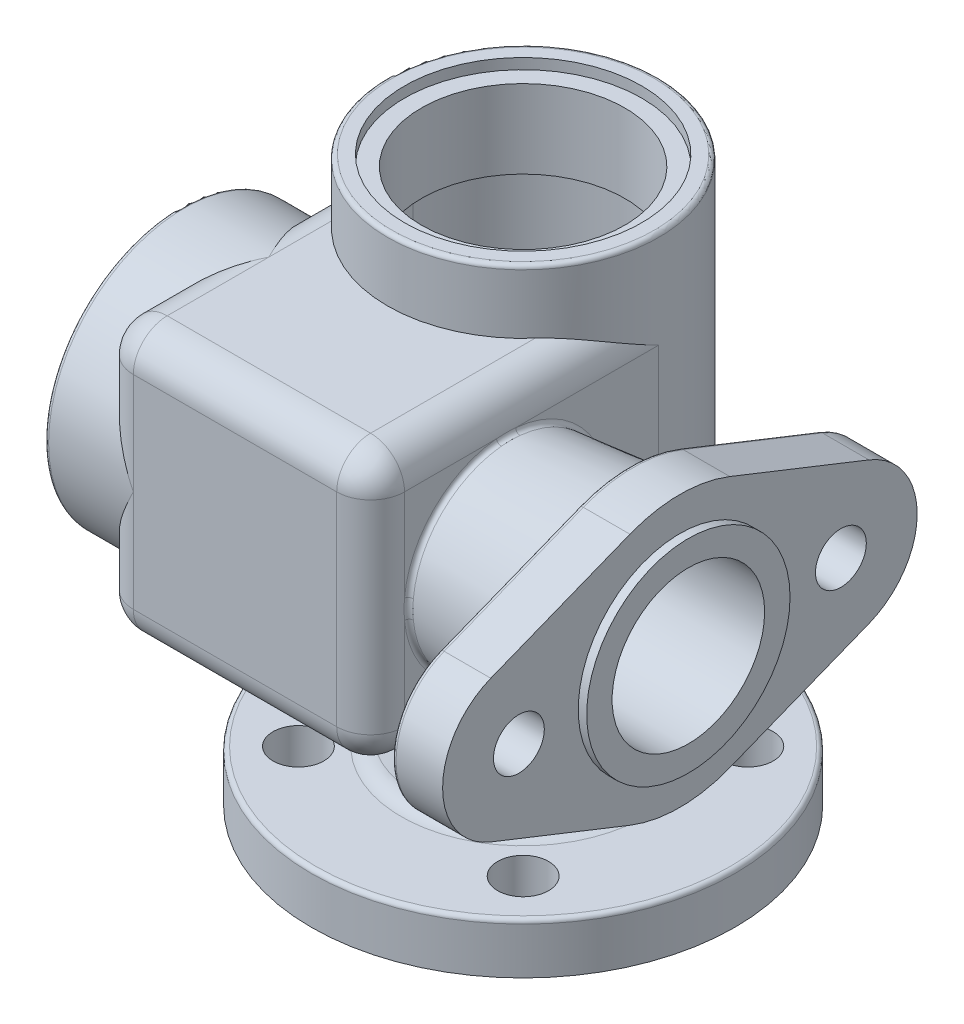
from build123d import *

# Parameters (mm, degrees)
EXTRUDE_1_REACH             = 169.693
EXTRUDE_1_END_RADIUS        = 32
SKETCH_2_W                  = 64
SKETCH_2_H                  = 64
EXTRUDE_1_DIRECTION_2_DEPTH = 32
FILLET_1_R                  = 8
FILLET_2_R                  = 8
SKETCH_4_R                  = 26
SKETCH_3_R                  = 23
EXTRUDE_2_DEPTH             = 12
SKETCH_6_R                  = 24
EXTRUDE_3_DEPTH             = 2
CUT_EXTRUDE_1_REACH         = 206.494
SKETCH_7_R                  = 6
SKETCH_8_R                  = 18
CUT_EXTRUDE_2_DEPTH         = 43
CUT_EXTRUDE_3_DEPTH         = 52
SKETCH_10_R                 = 28
CUT_EXTRUDE_4_DEPTH         = 2.5
CUT_EXTRUDE_5_REACH         = 179.891
SKETCH_11_R                 = 24
SKETCH_12_R                 = 12.5
CUT_EXTRUDE_6_DEPTH         = 39
SKETCH_13_R                 = 18
CUT_EXTRUDE_7_DEPTH         = 10
EXTRUDE_4_REACH             = 204.704
SKETCH_15_R                 = 32
SKETCH_16_R                 = 24
CUT_EXTRUDE_8_DEPTH         = 4
CUT_EXTRUDE_9_REACH         = 202.362
SKETCH_17_R                 = 19.5
SKETCH_18_R                 = 6
CUT_EXTRUDE_10_DEPTH        = 170.499262535
PATTERN_CIRCULAR_1_COUNT    = 4
FILLET_3_R                  = 1
FILLET_4_R                  = 1


with BuildPart() as part:
    # 草圖1 → 旋轉1 (revolve)
    with BuildSketch(Plane.XY, mode=Mode.PRIVATE) as revolve_1_sk:
        with BuildLine():
            Line((0, 0), (30, 0))
            Line((30, 0), (30, 2))
            Line((30, 2), (50, 2))
            Line((50, 2), (50, 13))
            ThreePointArc((50, 13), (49.707106781, 13.707106781), (49, 14))
            Line((49, 14), (28.772001873, 14))
            ThreePointArc((28.772001873, 14), (26.493622522, 14.71229753), (25.026685162, 16.595506234))
            Line((25.026685162, 16.595506234), (20.973673426, 27.403537532))
            ThreePointArc((20.973673426, 27.403537532), (20.822133836, 29.710533915), (21.972435676, 31.716026931))
            ThreePointArc((21.972435676, 31.716026931), (29.386373897, 42.313460141), (32, 54.979991994))
            Line((32, 54.979991994), (32, 134))
            ThreePointArc((32, 134), (31.707106781, 134.707106781), (31, 135))
            Line((31, 135), (0, 135))
            Line((0, 135), (0, 0))
        make_face()
    revolve(revolve_1_sk.sketch.rotate(Axis((0, 0, 0), (0, 1, 0)), 90), axis=Axis((0, 0, 0), (0, 1, 0)))

    # 填料-伸長1: up to this cylinder (the profile starts outside it)
    extrude_1_end = Plane(origin=(0, 88, 0), z_dir=(0, -1, 0)) * Cylinder(EXTRUDE_1_END_RADIUS, 404.386, mode=Mode.PRIVATE)
    # 草圖2 → 填料-伸長1 (add, up to the surface)
    with BuildSketch(Plane.XY.offset(36), mode=Mode.PRIVATE) as extrude_1_sk1:
        with Locations((0, 88)):
            Rectangle(SKETCH_2_W, SKETCH_2_H)
    extrude_1_tool1 = extrude(extrude_1_sk1.sketch, amount=-EXTRUDE_1_REACH, mode=Mode.PRIVATE) - extrude_1_end
    add(extrude_1_tool1.solids().sort_by_distance((0, 88, 36))[0])

    # 草圖2 → 填料-伸長1 direction 2 (add)
    with BuildSketch(Plane.XY.offset(36)):
        with Locations((0, 88)):
            Rectangle(SKETCH_2_W, SKETCH_2_H)
    extrude(amount=EXTRUDE_1_DIRECTION_2_DEPTH)

    # 圓角1
    # the kernel refuses this fillet: 8 mm, written as the material it takes off along each edge
    with BuildSketch(Plane(origin=(-32, 120, -20), x_dir=(0, -1, 0), z_dir=(0, 0, 1))) as fillet_1_piece_1_section:
        with BuildLine():
            CenterArc((FILLET_1_R, FILLET_1_R), FILLET_1_R, 180, 90)
            Line((0, FILLET_1_R), (0, 0))
            Line((0, 0), (FILLET_1_R, 0))
        make_face()
    fillet_1_piece_1 = extrude(amount=108, mode=Mode.PRIVATE)
    fillet_1_piece_1 = fillet_1_piece_1 - Plane(origin=(0, 118.142292592, 0), x_dir=(0, 0, -1), z_dir=(0, 1, 0)) * Cylinder(32, 248, mode=Mode.PRIVATE)
    add(fillet_1_piece_1, mode=Mode.SUBTRACT)
    with BuildSketch(Plane(origin=(-32, 56, -20), x_dir=(1, 0, 0), z_dir=(0, 0, 1))) as fillet_1_piece_2_section:
        with BuildLine():
            CenterArc((FILLET_1_R, FILLET_1_R), FILLET_1_R, 180, 90)
            Line((0, FILLET_1_R), (0, 0))
            Line((0, 0), (FILLET_1_R, 0))
        make_face()
    fillet_1_piece_2 = extrude(amount=108, mode=Mode.PRIVATE)
    fillet_1_piece_2 = fillet_1_piece_2 - Plane(origin=(0, 57.85770728, 0), x_dir=(0, 0, -1), z_dir=(0, 1, 0)) * Cylinder(32, 248, mode=Mode.PRIVATE)
    add(fillet_1_piece_2, mode=Mode.SUBTRACT)
    with BuildSketch(Plane(origin=(32, 56, 88), x_dir=(-1, 0, 0), z_dir=(0, 0, -1))) as fillet_1_piece_3_section:
        with BuildLine():
            CenterArc((FILLET_1_R, FILLET_1_R), FILLET_1_R, 180, 90)
            Line((0, FILLET_1_R), (0, 0))
            Line((0, 0), (FILLET_1_R, 0))
        make_face()
    fillet_1_piece_3 = extrude(amount=108, mode=Mode.PRIVATE)
    fillet_1_piece_3 = fillet_1_piece_3 - Plane(origin=(0, 57.857708175, 0), x_dir=(0, 0, -1), z_dir=(0, 1, 0)) * Cylinder(32, 248, mode=Mode.PRIVATE)
    add(fillet_1_piece_3, mode=Mode.SUBTRACT)
    with BuildSketch(Plane(origin=(32, 120, -20), x_dir=(-1, 0, 0), z_dir=(0, 0, 1))) as fillet_1_piece_4_section:
        with BuildLine():
            CenterArc((FILLET_1_R, FILLET_1_R), FILLET_1_R, 180, 90)
            Line((0, FILLET_1_R), (0, 0))
            Line((0, 0), (FILLET_1_R, 0))
        make_face()
    fillet_1_piece_4 = extrude(amount=108, mode=Mode.PRIVATE)
    fillet_1_piece_4 = fillet_1_piece_4 - Plane(origin=(0, 118.142291825, 0), x_dir=(0, 0, -1), z_dir=(0, 1, 0)) * Cylinder(32, 248, mode=Mode.PRIVATE)
    add(fillet_1_piece_4, mode=Mode.SUBTRACT)

    # 圓角2
    fillet_2_edges = [part.edges().sort_by_distance(p)[0] for p in [
        (0, 56, 68),
        (-32, 88, 68),
        (32, 88, 68),
        (0, 120, 68),
        (-29.656854249, 117.656854249, 68),
        (29.656854249, 117.656854249, 68),
        (29.656854249, 58.343145751, 68),
        (-29.656854249, 58.343145751, 68),
    ]]
    fillet(fillet_2_edges, radius=FILLET_2_R)

    # 草圖4 → 疊層拉伸1 section 0
    with BuildSketch(Plane(origin=(61, 0, 0), x_dir=(0, 0, -1), z_dir=(1, 0, 0))):
        with Locations((-36, 88)):
            Circle(SKETCH_4_R)
    # 草圖3 → 疊層拉伸1 section 1
    with BuildSketch(Plane(origin=(32, 0, 0), x_dir=(0, 0, -1), z_dir=(1, 0, 0))):
        with Locations((-36, 88)):
            Circle(SKETCH_3_R)
    loft()

    # 草圖5 → 填料-伸長2 (add)
    with BuildSketch(Plane(origin=(61, 0, 0), x_dir=(0, 0, -1), z_dir=(1, 0, 0))):
        with BuildLine():
            Line((-80.631578947, 104.733862694), (-47.789473684, 117.749089234))
            ThreePointArc((-47.789473684, 117.749089234), (-36, 120), (-24.210526316, 117.749089234))
            Line((-24.210526316, 117.749089234), (8.631578947, 104.733862694))
            ThreePointArc((8.631578947, 104.733862694), (20, 88), (8.631578947, 71.266137306))
            Line((8.631578947, 71.266137306), (-24.210526316, 58.250910766))
            ThreePointArc((-24.210526316, 58.250910766), (-36, 56), (-47.789473684, 58.250910766))
            Line((-47.789473684, 58.250910766), (-80.631578947, 71.266137306))
            ThreePointArc((-80.631578947, 71.266137306), (-92, 88), (-80.631578947, 104.733862694))
        make_face()
    extrude(amount=EXTRUDE_2_DEPTH)

    # 草圖6 → 填料-伸長3 (add)
    with BuildSketch(Plane(origin=(73, 0, 0), x_dir=(0, 0, -1), z_dir=(1, 0, 0))):
        with Locations((-36, 88)):
            Circle(SKETCH_6_R)
    extrude(amount=EXTRUDE_3_DEPTH)

    # 草圖7 → 除料-伸長1 (cut, up to next)
    with BuildSketch(Plane(origin=(73, 0, 0), x_dir=(0, 0, -1), z_dir=(1, 0, 0)), mode=Mode.PRIVATE) as cut_extrude_1_sk1:
        with Locations((-74, 88)):
            Circle(SKETCH_7_R)
    cut_extrude_1_tool1 = extrude(cut_extrude_1_sk1.sketch, amount=-CUT_EXTRUDE_1_REACH, mode=Mode.PRIVATE) & part.part
    # 草圖7 → 除料-伸長1 (cut, up to next)
    with BuildSketch(Plane(origin=(73, 0, 0), x_dir=(0, 0, -1), z_dir=(1, 0, 0)), mode=Mode.PRIVATE) as cut_extrude_1_sk2:
        with Locations((2, 88)):
            Circle(SKETCH_7_R)
    cut_extrude_1_tool2 = extrude(cut_extrude_1_sk2.sketch, amount=-CUT_EXTRUDE_1_REACH, mode=Mode.PRIVATE) & part.part
    add(cut_extrude_1_tool1.solids().sort_by_distance((73, 88, 74))[0], mode=Mode.SUBTRACT)
    add(cut_extrude_1_tool2.solids().sort_by_distance((73, 88, -2))[0], mode=Mode.SUBTRACT)

    # 草圖8 → 除料-伸長2 (cut)
    with BuildSketch(Plane(origin=(75, 0, 0), x_dir=(0, 0, -1), z_dir=(1, 0, 0))):
        with Locations((-36, 88)):
            Circle(SKETCH_8_R)
    extrude(amount=-CUT_EXTRUDE_2_DEPTH, mode=Mode.SUBTRACT)

    # 草圖9 → 除料-伸長3 (cut)
    with BuildSketch(Plane(origin=(0, 62, 0), x_dir=(1, 0, 0), z_dir=(0, 1, 0))):
        with BuildLine():
            Line((26, 0), (26, -62))
            Line((26, -62), (-26, -62))
            Line((-26, -62), (-26, 0))
            ThreePointArc((-26, 0), (0, 26), (26, 0))
        make_face()
    extrude(amount=CUT_EXTRUDE_3_DEPTH, mode=Mode.SUBTRACT)

    # 草圖10 → 除料-伸長4 (cut)
    with BuildSketch(Plane(origin=(0, 135, 0), x_dir=(1, 0, 0), z_dir=(0, 1, 0))):
        with Locations(Location((0, 0, 0), (0, 0, 270))):
            Circle(SKETCH_10_R)
    extrude(amount=-CUT_EXTRUDE_4_DEPTH, mode=Mode.SUBTRACT)

    # 草圖11 → 除料-伸長5 (cut, up to next)
    with BuildSketch(Plane(origin=(0, 132.5, 0), x_dir=(1, 0, 0), z_dir=(0, 1, 0)), mode=Mode.PRIVATE) as cut_extrude_5_sk1:
        with Locations(Location((0, 0, 0), (0, 0, 270))):
            Circle(SKETCH_11_R)
    cut_extrude_5_tool1 = extrude(cut_extrude_5_sk1.sketch, amount=-CUT_EXTRUDE_5_REACH, mode=Mode.PRIVATE) & part.part
    add(cut_extrude_5_tool1.solids().sort_by_distance((0, 132.5, 0))[0], mode=Mode.SUBTRACT)

    # 草圖12 → 除料-伸長6 (cut)
    with BuildSketch(Plane.XZ):
        with Locations(Location((0, 0, 0), (0, 0, 270))):
            Circle(SKETCH_12_R)
    extrude(amount=-CUT_EXTRUDE_6_DEPTH, mode=Mode.SUBTRACT)

    # 草圖13 → 除料-伸長7 (cut)
    with BuildSketch(Plane.XZ.offset(-39)):
        with Locations(Location((0, 0, 0), (0, 0, 270))):
            Circle(SKETCH_13_R)
    extrude(amount=-CUT_EXTRUDE_7_DEPTH, mode=Mode.SUBTRACT)

    # 草圖15 → 填料-伸長4 (add, up to next)
    with BuildSketch(Plane(origin=(-45, 0, 0), x_dir=(0, 0, -1), z_dir=(1, 0, 0)), mode=Mode.PRIVATE) as extrude_4_sk1:
        with Locations(Location((-36, 88, 0), (0, 0, 180))):
            Circle(SKETCH_15_R)
    extrude_4_tool1 = extrude(extrude_4_sk1.sketch, amount=EXTRUDE_4_REACH, mode=Mode.PRIVATE) - part.part
    add(extrude_4_tool1.solids().sort_by_distance((-45, 88, 36))[0])

    # 草圖16 → 除料-伸長8 (cut)
    with BuildSketch(Plane.ZY.offset(45)):
        with Locations(Location((36, 88, 0), (0, 0, 180))):
            Circle(SKETCH_16_R)
    extrude(amount=-CUT_EXTRUDE_8_DEPTH, mode=Mode.SUBTRACT)

    # 草圖17 → 除料-伸長9 (cut, up to next)
    with BuildSketch(Plane.ZY.offset(41), mode=Mode.PRIVATE) as cut_extrude_9_sk1:
        with Locations((36, 88)):
            Circle(SKETCH_17_R)
    cut_extrude_9_tool1 = extrude(cut_extrude_9_sk1.sketch, amount=-CUT_EXTRUDE_9_REACH, mode=Mode.PRIVATE) & part.part
    add(cut_extrude_9_tool1.solids().sort_by_distance((-41, 88, 36))[0], mode=Mode.SUBTRACT)

    # 草圖18 → 除料-伸長10 (cut, through all)
    with BuildSketch(Plane(origin=(0, 14, 0), x_dir=(1, 0, 0), z_dir=(0, 1, 0))):
        with Locations(Location((26.516504294, 26.516504294, 0), (0, 0, 270))):
            Circle(SKETCH_18_R)
    cut_extrude_10 = extrude(amount=-CUT_EXTRUDE_10_DEPTH, mode=Mode.SUBTRACT)

    # 環狀複製排列1: 除料-伸長10 ×4 about axis
    pattern_circular_1_axis = Axis((0, 0, 0), (0, 1, 0))
    for i in range(1, PATTERN_CIRCULAR_1_COUNT):
        add(cut_extrude_10.rotate(pattern_circular_1_axis, i * 360 / PATTERN_CIRCULAR_1_COUNT), mode=Mode.SUBTRACT)

    # 圓角3
    fillet_3_edges = [part.edges().sort_by_distance(p)[0] for p in [
        (61, 88, 92),
        (61, 64.758524036, 64.210526316),
        (61, 56, 36),
        (61, 64.758524036, 7.789473684),
        (61, 88, -20),
        (61, 111.241475964, 7.789473684),
        (61, 120, 36),
        (61, 111.241475964, 64.210526316),
    ]]
    fillet(fillet_3_edges, radius=FILLET_3_R)

    # 圓角4
    # the kernel refuses this fillet: 1 mm, written as the material it adds along each edge
    with BuildSketch(Plane(origin=(61, 88, 36), x_dir=(0, 0, -1), z_dir=(0, -1, 0))) as fillet_4_piece_1:
        with BuildLine():
            CenterArc((26 + FILLET_4_R * 0.901888257732, -FILLET_4_R), FILLET_4_R, 90, 84.093858886)
            Line((26 - FILLET_4_R * 0.0928035360946, -FILLET_4_R * 0.897100848914), (26 - FILLET_4_R * 0.112697371971, -FILLET_4_R * 0.895042865893))
            Line((26 - FILLET_4_R * 0.112697371971, -FILLET_4_R * 0.895042865893), (26 - FILLET_4_R * 0.0180377651546, FILLET_4_R * 0.02))
            Line((26 - FILLET_4_R * 0.0180377651546, FILLET_4_R * 0.02), (26 + FILLET_4_R * 0.901888257732, FILLET_4_R * 0.02))
            Line((26 + FILLET_4_R * 0.901888257732, FILLET_4_R * 0.02), (26 + FILLET_4_R * 0.901888257732, 0))
        make_face()
    revolve(axis=Axis((61, 88, 36), (1, 0, 0)))
    with BuildSketch(Plane(origin=(32, 88, 36), x_dir=(0, 0, -1), z_dir=(0, -1, 0))) as fillet_4_piece_2:
        with BuildLine():
            CenterArc((23 + FILLET_4_R * 1.10878480946, FILLET_4_R), FILLET_4_R, 174.093858886, 95.906141114)
            Line((23 + FILLET_4_R * 1.10878480946, 0), (23 + FILLET_4_R * 1.10878480946, -FILLET_4_R * 0.02))
            Line((23 + FILLET_4_R * 1.10878480946, -FILLET_4_R * 0.02), (23 - FILLET_4_R * 0.0221756961891, -FILLET_4_R * 0.02))
            Line((23 - FILLET_4_R * 0.0221756961891, -FILLET_4_R * 0.02), (23 + FILLET_4_R * 0.094199179753, FILLET_4_R * 1.10495713411))
            Line((23 + FILLET_4_R * 0.094199179753, FILLET_4_R * 1.10495713411), (23 + FILLET_4_R * 0.11409301563, FILLET_4_R * 1.10289915109))
        make_face()
    revolve(axis=Axis((32, 88, 36), (1, 0, 0)))
    # the kernel refuses this fillet: 1 mm, written as the material it takes off along each edge
    with BuildSketch(Plane(origin=(-45, 88, 36), x_dir=(0, 0, 1), z_dir=(0, 1, 0))) as fillet_4_2_piece_1:
        with BuildLine():
            CenterArc((32 - FILLET_4_R, FILLET_4_R), FILLET_4_R, 270, 90)
            Line((32 - FILLET_4_R, 0), (32 - FILLET_4_R, -FILLET_4_R * 0.02))
            Line((32 - FILLET_4_R, -FILLET_4_R * 0.02), (32 + FILLET_4_R * 0.02, -FILLET_4_R * 0.02))
            Line((32 + FILLET_4_R * 0.02, -FILLET_4_R * 0.02), (32 + FILLET_4_R * 0.02, FILLET_4_R))
            Line((32 + FILLET_4_R * 0.02, FILLET_4_R), (32, FILLET_4_R))
        make_face()
    revolve(axis=Axis((-45, 88, 36), (1, 0, 0)), mode=Mode.SUBTRACT)


solid = part.part
